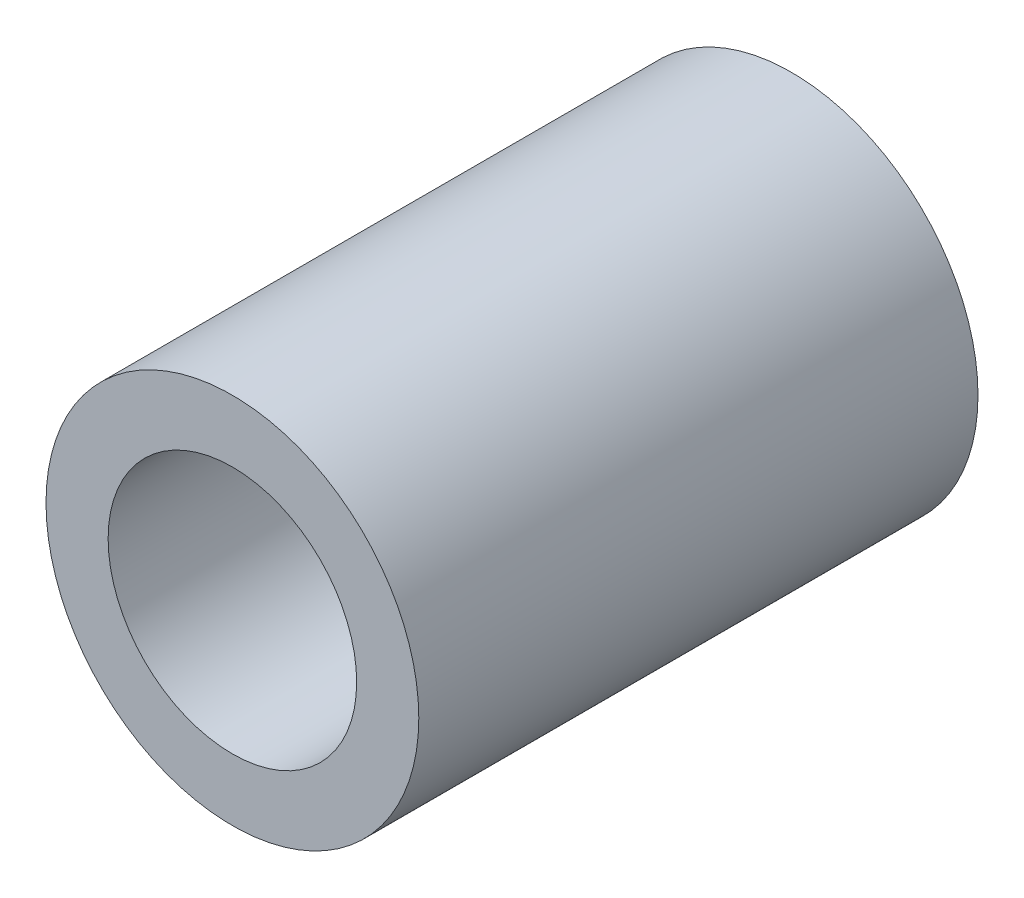
from build123d import *

# Parameters (mm, degrees)
SKETCH_1_R          = 3
EXTRUDE_1_DEPTH     = 10
SKETCH_2_R          = 2
CUT_EXTRUDE_1_DEPTH = 9
CUT_EXTRUDE_START   = -1
SKETCH_10_R         = 3
CUT_EXTRUDE_2_DEPTH = 1


with BuildPart() as part:
    # 草图1 → 凸台-拉伸1 (new body)
    with BuildSketch(Plane.XY):
        Circle(SKETCH_1_R)
    extrude(amount=EXTRUDE_1_DEPTH)

    # 草图2 → 切除-拉伸1 (cut)
    with BuildSketch(Plane.XY.offset(10)):
        Circle(SKETCH_2_R)
    extrude(amount=-CUT_EXTRUDE_1_DEPTH, mode=Mode.SUBTRACT)

    # 草图8 → 大小mm 暗销孔2 (revolve, cut)
    with BuildSketch(Plane(origin=(0, 0, 1), x_dir=(0, -1, 0), z_dir=(1, 0, 0))):
        Polygon((0, 0), (0, 1), (1, 1), (1, 0.025), (1.025, 0), align=None)
    revolve(axis=Axis((0, 0, 7.35), (0, 0, -1)), mode=Mode.SUBTRACT)

    # 草图10 → 切除-拉伸2 (cut)
    with BuildSketch(Plane.XY.offset(10).offset(CUT_EXTRUDE_START)):
        Circle(SKETCH_10_R)
    extrude(amount=CUT_EXTRUDE_2_DEPTH, mode=Mode.SUBTRACT)


solid = part.part
